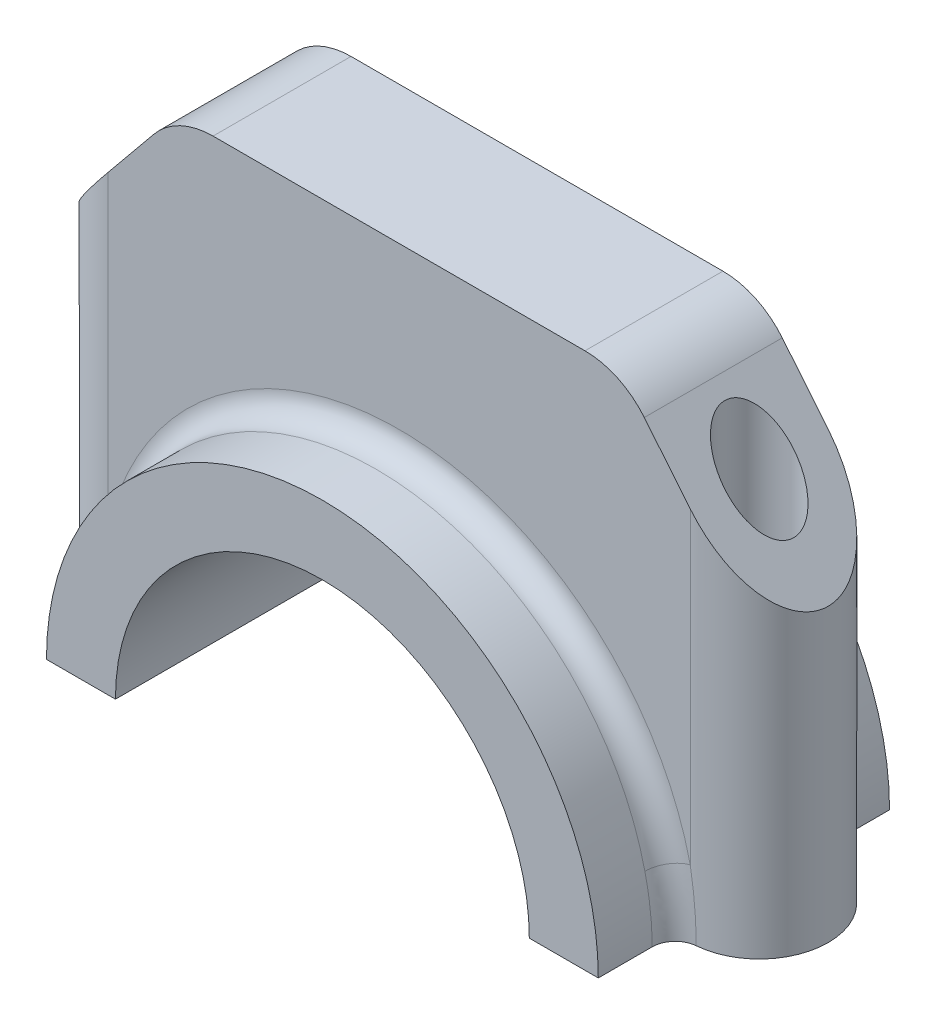
from build123d import *

# Parameters (mm, degrees)
SKETCH1_R                = 4.500000000000004
SKETCH1_R_2              = 4.5
BOSS_EXTRUDE1_DEPTH      = 60
CUT_EXTRUDE1_DEPTH       = 106.58882516630251
CUT_EXTRUDE2_DEPTH       = 106.58882516630251
BOSS_EXTRUDE2_DEPTH      = 10
BOSS_EXTRUDE2_DEPTH_BACK = 28
SKETCH6_R                = 4.500000000000004
SKETCH6_R_2              = 4.499999999999999
CUT_EXTRUDE3_DEPTH       = 106.76388797694608
FILLET1_R                = 3
FILLET2_R                = 10


with BuildPart() as part:
    # Sketch1 → Boss-Extrude1 (new body)
    with BuildSketch(Plane(origin=(0, 0, 0), x_dir=(1, 0, 0), z_dir=(0, 1, 0))):
        with BuildLine():
            Line((0, -9), (-76, -9))
            ThreePointArc((-76, -9), (-85, 1.1e-15), (-76, 9))
            Line((-76, 9), (0, 9))
            ThreePointArc((0, 9), (9, 0), (0, -9))
        make_face()
        with Locations((-76, 0)):
            Circle(SKETCH1_R, mode=Mode.SUBTRACT)
        Circle(SKETCH1_R_2, mode=Mode.SUBTRACT)
    extrude(amount=BOSS_EXTRUDE1_DEPTH)

    # Sketch3 → Cut-Extrude1 (cut, through all)
    with BuildSketch(Plane.XY.offset(9)):
        Polygon((-84.99999999999999, 60), (-84.99999999999999, 38), (-66.99999999999999, 60), align=None)
        Polygon((-9.000000000000007, 60), (8.999999999999993, 38), (8.999999999999995, 60), align=None)
    extrude(amount=-CUT_EXTRUDE1_DEPTH, mode=Mode.SUBTRACT)

    # Sketch5 → Cut-Extrude2 (cut, through all)
    with BuildSketch(Plane.XY.offset(9)):
        with BuildLine():
            ThreePointArc((-11, 0), (-38, 27), (-65, 5.08e-15))
            Line((-65, 0), (-11, 0))
        make_face()
    extrude(amount=-CUT_EXTRUDE2_DEPTH, mode=Mode.SUBTRACT)

    # Sketch5<3> → Boss-Extrude2 (add, two sides: drawn at the far end of the back side and taken through both)
    with BuildSketch(Plane.XY.offset(9).offset(-BOSS_EXTRUDE2_DEPTH_BACK)):
        with BuildLine():
            Line((-73.99999999999999, 0), (-65, 0))
            ThreePointArc((-65, 5.08e-15), (-38, 27), (-11, 0))
            Line((-11, 0), (-2.000000000000009, 0))
            ThreePointArc((-2.000000000000014, 0), (-38, 35.99999999999999), (-73.99999999999999, -9.2e-16))
        make_face()
    extrude(amount=BOSS_EXTRUDE2_DEPTH + BOSS_EXTRUDE2_DEPTH_BACK)

    # Sketch6 → Cut-Extrude3 (cut, through all)
    with BuildSketch(Plane.XZ):
        with Locations((-76, 0)):
            Circle(SKETCH6_R)
        Circle(SKETCH6_R_2)
    extrude(amount=-CUT_EXTRUDE3_DEPTH, mode=Mode.SUBTRACT)

    # Fillet1
    fillet1_edges = [part.edges().sort_by_distance(p)[0] for p in [
        (-38, 35.99999999999999, -9),
        (-38, 35.99999999999999, 9),
    ]]
    fillet(fillet1_edges, radius=FILLET1_R)

    # Fillet2
    fillet2_edges = [part.edges().sort_by_distance(p)[0] for p in [
        (-9.000000000000007, 60, 0),
        (-66.99999999999999, 60, 0),
    ]]
    fillet(fillet2_edges, radius=FILLET2_R)


solid = part.part
